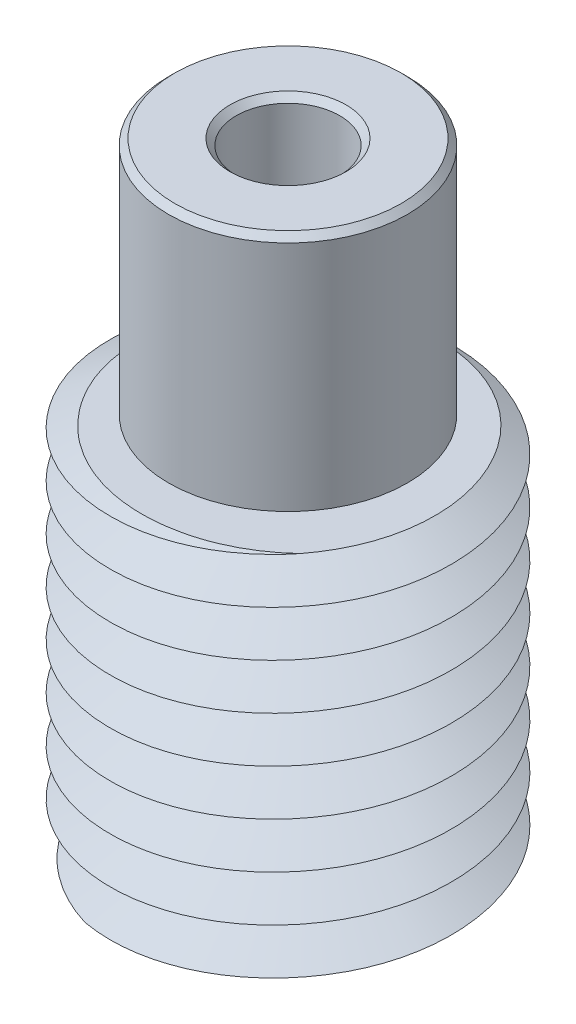
from build123d import *

# Parameters (mm, degrees)
SKETCH1_R          = 4.7625
EXTRUDE1_DEPTH     = 9.525
CHAMFER1_SIZE      = 0.25
SKETCH2_R          = 6.8707
EXTRUDE2_DEPTH     = 14.9352
SKETCH5_R          = 2.06375
CUT_EXTRUDE1_DEPTH = 27.319468479
CHAMFER2_SIZE      = 0.25
CHAMFER3_SIZE      = 0.25
CUT_SWEEP2_PITCH   = 1.8288


with BuildPart() as part:
    # Sketch1 → Extrude1 (new body)
    with BuildSketch(Plane(origin=(0, 0, 0), x_dir=(1, 0, 0), z_dir=(0, 1, 0))):
        with Locations(Location((0, 0, 0), (0, 0, 90))):
            Circle(SKETCH1_R)
    extrude(amount=EXTRUDE1_DEPTH)

    # Chamfer1
    chamfer1_edges = [part.edges().sort_by_distance(p)[0] for p in [
        (0, 9.525, 4.7625),
    ]]
    chamfer(chamfer1_edges, length=CHAMFER1_SIZE)

    # Sketch2 → Extrude2 (add)
    with BuildSketch(Plane.XZ):
        with Locations(Location((0, 0, 0), (0, 0, 270))):
            Circle(SKETCH2_R)
    extrude(amount=EXTRUDE2_DEPTH)

    # Sketch5 → Cut-Extrude1 (cut, through all)
    with BuildSketch(Plane(origin=(0, 9.525, 0), x_dir=(1, 0, 0), z_dir=(0, 1, 0))):
        with Locations(Location((0, 0, 0), (0, 0, 270))):
            Circle(SKETCH5_R)
    extrude(amount=-CUT_EXTRUDE1_DEPTH, mode=Mode.SUBTRACT)

    # Chamfer2
    chamfer2_edges = [part.edges().sort_by_distance(p)[0] for p in [
        (0, 9.525, -2.06375),
    ]]
    chamfer(chamfer2_edges, length=CHAMFER2_SIZE)

    # Chamfer3
    chamfer3_edges = [part.edges().sort_by_distance(p)[0] for p in [
        (0, -14.9352, -2.06375),
    ]]
    chamfer(chamfer3_edges, length=CHAMFER3_SIZE)

    # Cut-Sweep2: arcs per turn and ends read off the stored shape
    # Cut-Sweep2: the profile of Sketch11 profile screwed along a right-hand helix through 17 turns, 6 arcs to a turn; built about Z, then put on its axis
    cut_sweep2_z = Axis((0, 0, 0), (0, 0, 1))
    cut_sweep2_corners = [(6.871, 3.8375e-05, 0.025952658), (5.059980123, 2.826e-05, -0.914322075), (6.871, 3.8375e-05, -1.854596807)]
    with BuildLine(mode=Mode.PRIVATE) as cut_sweep2_profile:
        Line(cut_sweep2_corners[0], cut_sweep2_corners[1])
        Line(cut_sweep2_corners[1], cut_sweep2_corners[2])
        Line(cut_sweep2_corners[2], cut_sweep2_corners[0])
    cut_sweep2_cap = Face(cut_sweep2_profile.wire())
    cut_sweep2_turn_angles = [0, 30, 60, 90, 120, 150, 180, 210, 240, 270, 300, 330, 360]
    cut_sweep2_turn_weights = [1, 0.8660254037844387, 1, 0.8660254037844387, 1, 0.8660254037844387, 1, 0.8660254037844387, 1, 0.8660254037844387, 1, 0.8660254037844387, 1]
    cut_sweep2_turn_rails = [Edge.make_bspline([Vector(p[0], p[1], 0).rotate(cut_sweep2_z, cut_sweep2_turn_angles[k]) / cut_sweep2_turn_weights[k] + Vector(0, 0, p[2] + CUT_SWEEP2_PITCH * cut_sweep2_turn_angles[k] / 360) for k in range(13)], [0, 0, 0, 1, 1, 2, 2, 3, 3, 4, 4, 5, 5, 6, 6, 6], 2, cut_sweep2_turn_weights) for p in cut_sweep2_corners]
    cut_sweep2_turn_sides = [Face.make_surface_from_curves(cut_sweep2_turn_rails[p[0]], cut_sweep2_turn_rails[p[1]]) for p in [(0, 1), (1, 2), (2, 0)]]
    cut_sweep2_turn = Solid(Shell([*cut_sweep2_turn_sides, cut_sweep2_cap, cut_sweep2_cap.rotate(cut_sweep2_z, 360).moved(Location((0, 0, CUT_SWEEP2_PITCH * 360 / 360)))]))
    cut_sweep2_each = [*[cut_sweep2_turn.moved(Location((0, 0, CUT_SWEEP2_PITCH * i))) for i in range(17)]]
    add(Plane(origin=(0, -24.9352, 0), x_dir=(0, 0, -1), z_dir=(0, 1, 0)) * Compound([cut_sweep2_each[i] for i in range(0, 17, 2)]), mode=Mode.SUBTRACT)
    add(Plane(origin=(0, -24.9352, 0), x_dir=(0, 0, -1), z_dir=(0, 1, 0)) * Compound([cut_sweep2_each[i] for i in range(1, 17, 2)]), mode=Mode.SUBTRACT)


solid = part.part
